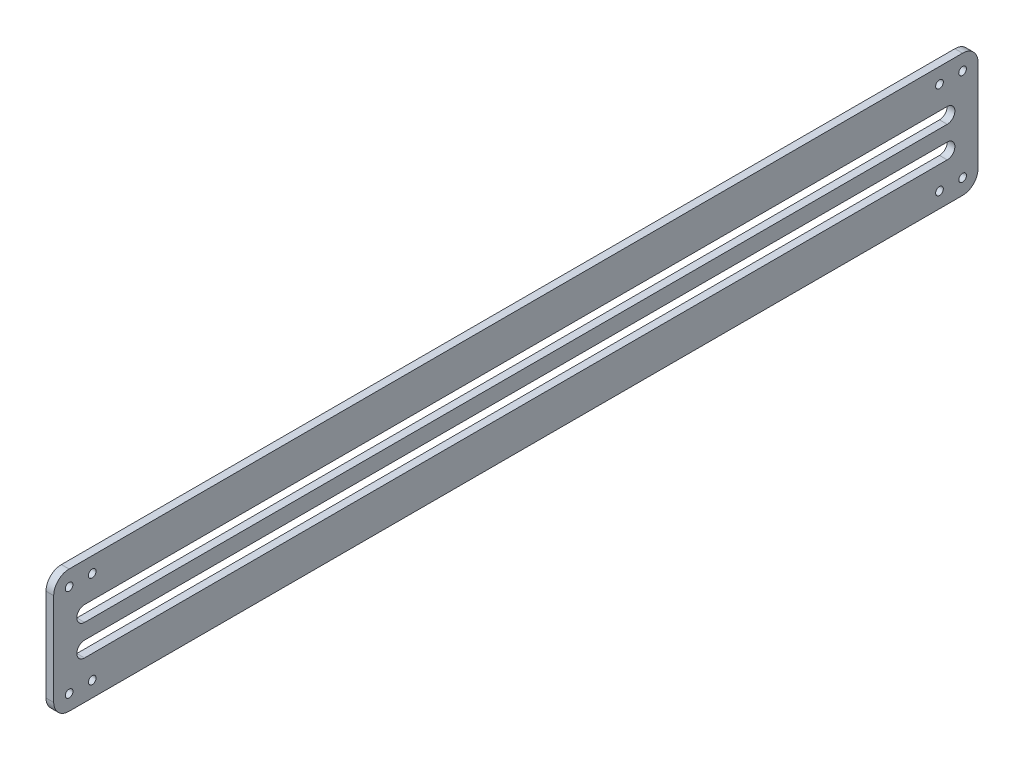
from build123d import *

# Parameters (mm, degrees)
OUTER_CUT_DEPTH   = 1.5875
SLOTS_DEPTH       = 193.212098019
SKETCH3_R         = 1.5875
MOUNT_HOLES_DEPTH = 193.212098019


with BuildPart() as part:
    # Sketch1 → Outer Cut (new, symmetric)
    with BuildSketch(Plane(origin=(0, 0, 0), x_dir=(0, 0, -1), z_dir=(1, 0, 0))):
        with BuildLine():
            Line((-184.15, -25.4), (184.15, -25.4))
            ThreePointArc((184.15, -25.4), (188.640128061, -23.540128061), (190.5, -19.05))
            Line((190.5, -19.05), (190.5, 19.05))
            ThreePointArc((190.5, 19.05), (188.640128061, 23.540128061), (184.15, 25.4))
            Line((184.15, 25.4), (-184.15, 25.4))
            ThreePointArc((-184.15, 25.4), (-188.640128061, 23.540128061), (-190.5, 19.05))
            Line((-190.5, 19.05), (-190.5, -19.05))
            ThreePointArc((-190.5, -19.05), (-188.640128061, -23.540128061), (-184.15, -25.4))
        make_face()
    extrude(amount=OUTER_CUT_DEPTH, both=True)

    # Sketch2 → Slots (cut, through all)
    with BuildSketch(Plane(origin=(1.5875, 0, 0), x_dir=(0, 0, -1), z_dir=(1, 0, 0))):
        with BuildLine():
            Line((-177.8, 9.525), (177.8, 9.525))
            ThreePointArc((177.8, 9.525), (180.975, 6.35), (177.8, 3.175))
            Line((177.8, 3.175), (-177.8, 3.175))
            ThreePointArc((-177.8, 3.175), (-180.975, 6.35), (-177.8, 9.525))
        make_face()
        with BuildLine():
            Line((-177.8, -9.525), (177.8, -9.525))
            ThreePointArc((177.8, -9.525), (180.975, -6.35), (177.8, -3.175))
            Line((177.8, -3.175), (-177.8, -3.175))
            ThreePointArc((-177.8, -3.175), (-180.975, -6.35), (-177.8, -9.525))
        make_face()
    extrude(amount=-SLOTS_DEPTH, mode=Mode.SUBTRACT)

    # Sketch3 → Mount Holes (cut, through all)
    with BuildSketch(Plane(origin=(1.5875, 0, 0), x_dir=(0, 0, -1), z_dir=(1, 0, 0))):
        with Locations((-184.15, 19.05)):
            Circle(SKETCH3_R)
        with Locations((-174.625, 19.05)):
            Circle(SKETCH3_R)
        with Locations((-174.625, -19.05)):
            Circle(SKETCH3_R)
        with Locations((-184.15, -19.05)):
            Circle(SKETCH3_R)
        with Locations((174.625, 19.05)):
            Circle(SKETCH3_R)
        with Locations((184.15, 19.05)):
            Circle(SKETCH3_R)
        with Locations((184.15, -19.05)):
            Circle(SKETCH3_R)
        with Locations((174.625, -19.05)):
            Circle(SKETCH3_R)
    extrude(amount=-MOUNT_HOLES_DEPTH, mode=Mode.SUBTRACT)


solid = part.part
